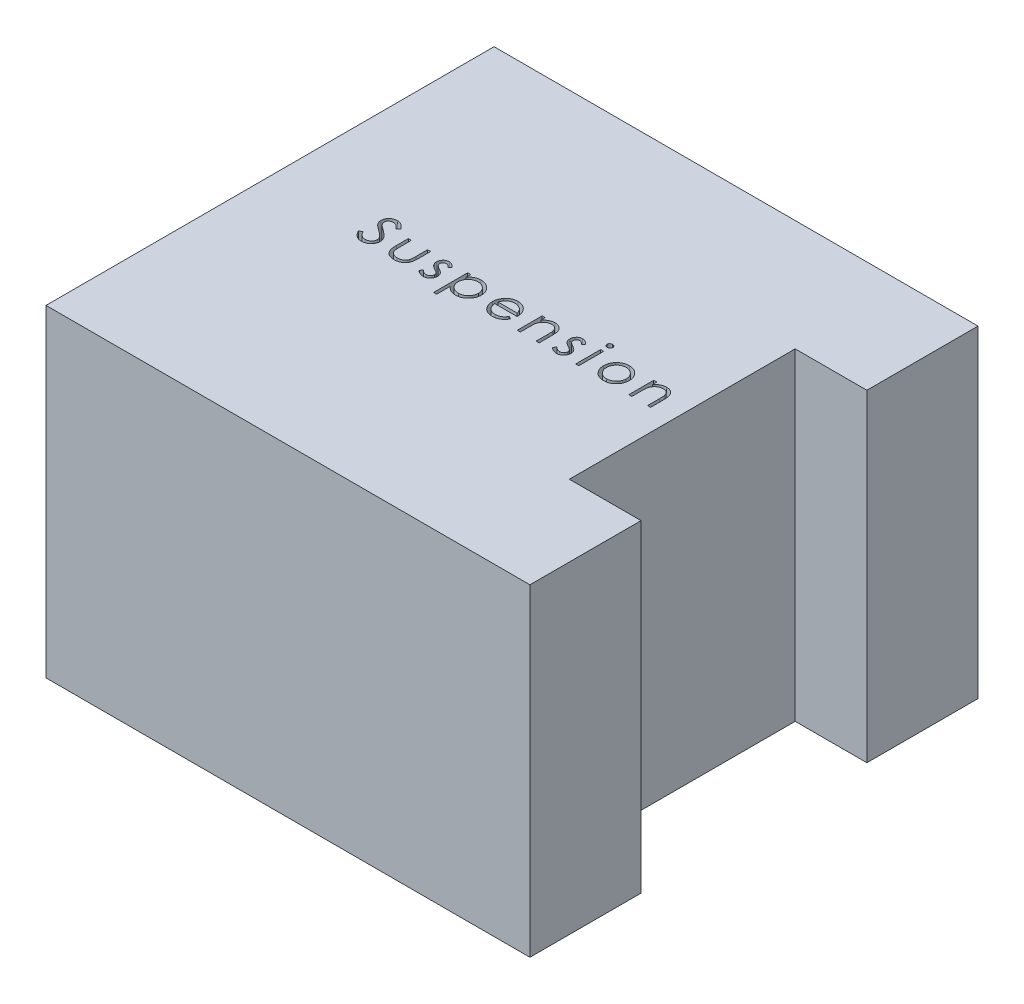
from build123d import *

# Parameters (mm, degrees)
BOSS_EXTRUDE1_DEPTH      = 90
BOSS_EXTRUDE1_DEPTH_BACK = 90
SKETCH1_W                = 270
SKETCH1_H                = 250
SKETCH2_W                = 1.709615384
SKETCH2_H                = 13.921153847
CUT_EXTRUDE1_DEPTH       = 50
SKETCH3_W                = 80.009413916
SKETCH3_H                = 126
CUT_EXTRUDE2_DEPTH       = 258.390753626


with BuildPart() as part:
    # Sketch1 → Boss-Extrude1 (new, two sides: drawn at the far end of the back side and taken through both)
    with BuildSketch(Plane(origin=(0, 0, 0), x_dir=(1, 0, 0), z_dir=(0, 1, 0)).offset(-BOSS_EXTRUDE1_DEPTH_BACK)):
        Rectangle(SKETCH1_W, SKETCH1_H)
    extrude(amount=BOSS_EXTRUDE1_DEPTH + BOSS_EXTRUDE1_DEPTH_BACK)

    # Sketch2 → Cut-Extrude1 (cut)
    # profile 1 of 11: a face of its own
    with BuildSketch(Plane(origin=(0, 90, 0), x_dir=(1, 0, 0), z_dir=(0, 1, 0))):
        with BuildLine():
            Line((-83.832526116, -1.8806457), (-82.222129481, -0.91517094))
            add(Edge.make_bspline(
                [(-82.222129481, -0.91517094), (-82.072351647, -1.165892807), (-81.785383097, -1.646266228), (-81.306676413, -2.295370705), (-80.810652997, -2.847070444), (-80.293639624, -3.298155979), (-79.758792107, -3.653296349), (-79.2026189, -3.904768495), (-78.626994244, -4.061609733), (-78.235251016, -4.080660204), (-78.039677558, -4.09017094)],
                knots=[0, 0, 0, 0, 1.272034388, 2.437168799, 3.508375237, 4.49857839, 5.41946034, 6.295179144, 7.148887113, 8, 8, 8, 8], degree=3))
            add(Edge.make_bspline(
                [(-78.039677558, -4.09017094), (-77.87265336, -4.08551908), (-77.541527496, -4.076296756), (-77.054053002, -3.987682676), (-76.580623478, -3.851545231), (-76.130996464, -3.656577018), (-75.711376048, -3.420691832), (-75.343402463, -3.135779066), (-75.025288619, -2.81679386), (-74.765070438, -2.460925412), (-74.565426246, -2.078199217), (-74.411980845, -1.685355825), (-74.326826944, -1.276224046), (-74.313999472, -1.000758527), (-74.307526116, -0.861745459)],
                knots=[0, 0, 0, 0, 1.095163259, 2.171163733, 3.241058638, 4.321873601, 5.38011039, 6.391990106, 7.366004449, 8.327778327, 9.272591725, 10.192022065, 11.087607919, 12, 12, 12, 12], degree=3))
            add(Edge.make_bspline(
                [(-74.307526116, -0.861745459), (-74.315550578, -0.703135977), (-74.331863138, -0.380706078), (-74.469738765, 0.094997747), (-74.686632523, 0.56576445), (-74.886726341, 0.856964196), (-74.990609049, 1.008146368)],
                knots=[0, 0, 0, 0, 0.938893495, 1.908633276, 2.914225137, 4, 4, 4, 4], degree=3))
            add(Edge.make_bspline(
                [(-74.990609049, 1.008146368), (-75.075901963, 1.117258365), (-75.254963768, 1.346325354), (-75.562798229, 1.687294421), (-75.924019508, 2.039003244), (-76.326266, 2.414881826), (-76.784190383, 2.797448262), (-77.28345014, 3.204945603), (-77.836792001, 3.621877044), (-78.224864976, 3.90149058), (-78.425104241, 4.04576656)],
                knots=[0, 0, 0, 0, 0.722233717, 1.516239348, 2.393582979, 3.351407094, 4.387010283, 5.505090956, 6.712668013, 8, 8, 8, 8], degree=3))
            add(Edge.make_bspline(
                [(-78.425104241, 4.04576656), (-78.625531991, 4.188525015), (-79.008734588, 4.461468311), (-79.544630587, 4.866549057), (-80.023844021, 5.236902118), (-80.444244954, 5.576013956), (-80.805648474, 5.883930561), (-81.110902468, 6.157695059), (-81.3522309, 6.404711297), (-81.486427703, 6.564956314), (-81.54667876, 6.636902377)],
                knots=[0, 0, 0, 0, 1.452282411, 2.77665338, 3.964542531, 5.026858415, 5.96415736, 6.766646006, 7.446254459, 8, 8, 8, 8], degree=3))
            add(Edge.make_bspline(
                [(-81.54667876, 6.636902377), (-81.630893613, 6.749030878), (-81.796513425, 6.969546623), (-82.015131254, 7.314214777), (-82.200945841, 7.66703855), (-82.346609391, 8.028966042), (-82.469270811, 8.394916154), (-82.551773262, 8.769663649), (-82.60343358, 9.151526987), (-82.608723964, 9.408503326), (-82.61137227, 9.537142762)],
                knots=[0, 0, 0, 0, 1.068054152, 2.10047183, 3.106115577, 4.101338837, 5.06977816, 6.043150881, 7.020423561, 8, 8, 8, 8], degree=3))
            add(Edge.make_bspline(
                [(-82.61137227, 9.537142762), (-82.604268204, 9.738690535), (-82.590211916, 10.137478139), (-82.4713371, 10.720031659), (-82.283706065, 11.27621773), (-82.02084389, 11.800529975), (-81.681986012, 12.279316242), (-81.289850065, 12.718083935), (-80.822790405, 13.086938647), (-80.310331127, 13.409221422), (-79.749410016, 13.661475672), (-79.161630956, 13.851763293), (-78.546059749, 13.959582253), (-78.129119831, 13.975055016), (-77.917562174, 13.982905983)],
                knots=[0, 0, 0, 0, 1.005424448, 1.989358655, 2.955360095, 3.929531133, 4.905563448, 5.876582895, 6.856512386, 7.866279853, 8.892233794, 9.918561126, 10.94386622, 12, 12, 12, 12], degree=3))
            add(Edge.make_bspline(
                [(-77.917562174, 13.982905983), (-77.693076428, 13.975163238), (-77.246645927, 13.959765389), (-76.589969483, 13.82588454), (-75.957723298, 13.604356598), (-75.449124956, 13.352958331), (-75.051073783, 13.101871625), (-74.747510767, 12.873163724), (-74.439894356, 12.609864919), (-74.125743229, 12.31127388), (-73.810380497, 11.974650849), (-73.489124278, 11.602301242), (-73.161223329, 11.196500559), (-72.950280719, 10.906807205), (-72.8421415, 10.758296608)],
                knots=[0, 0, 0, 0, 1.286793592, 2.559021753, 3.825965368, 5.121522368, 5.803751409, 6.523245864, 7.299691795, 8.125521123, 9.008227632, 9.944561021, 10.946284179, 12, 12, 12, 12], degree=3))
            Line((-72.8421415, 10.758296608), (-74.387664337, 9.586752137))
            add(Edge.make_bspline(
                [(-74.387664337, 9.586752137), (-74.480987198, 9.706977723), (-74.660705209, 9.938504093), (-74.933552844, 10.262742254), (-75.190720485, 10.558923378), (-75.444087661, 10.816180718), (-75.680272998, 11.048602329), (-75.909510042, 11.247591863), (-76.128499868, 11.415099032), (-76.404544768, 11.593861837), (-76.751351206, 11.771062235), (-77.18669561, 11.921007931), (-77.641643765, 12.011114768), (-77.951503616, 12.023028571), (-78.108367462, 12.029059829)],
                knots=[0, 0, 0, 0, 1.181633172, 2.275549214, 3.290209073, 4.226197932, 5.078386478, 5.862611352, 6.581680152, 7.217281963, 8.414376989, 9.595101626, 10.782541182, 12, 12, 12, 12], degree=3))
            add(Edge.make_bspline(
                [(-78.108367462, 12.029059829), (-78.305162248, 12.022464719), (-78.684662455, 12.009746671), (-79.223452169, 11.870845037), (-79.708377675, 11.652140912), (-80.12504235, 11.345626531), (-80.471953611, 10.982473699), (-80.722899037, 10.56457736), (-80.873939218, 10.103118854), (-80.892370255, 9.781219267), (-80.901756885, 9.617280983)],
                knots=[0, 0, 0, 0, 1.14458467, 2.207223713, 3.21896685, 4.227309161, 5.202851033, 6.127160689, 7.046193047, 8, 8, 8, 8], degree=3))
            add(Edge.make_bspline(
                [(-80.901756885, 9.617280983), (-80.899617153, 9.515219364), (-80.89533419, 9.310929235), (-80.835599934, 9.009115067), (-80.758859301, 8.708063348), (-80.637251548, 8.409127576), (-80.469364967, 8.107079708), (-80.248901081, 7.796718536), (-79.971242911, 7.475308522), (-79.758552315, 7.266262673), (-79.646258087, 7.155892762)],
                knots=[0, 0, 0, 0, 0.858281714, 1.717966888, 2.583508476, 3.4729293, 4.427298488, 5.488583878, 6.674047936, 8, 8, 8, 8], degree=3))
            add(Edge.make_bspline(
                [(-79.646258087, 7.155892762), (-79.604558331, 7.118679807), (-79.505489257, 7.030270344), (-79.324373147, 6.88553236), (-79.085198774, 6.706991556), (-78.794211651, 6.486080591), (-78.446046439, 6.229822919), (-78.040664855, 5.941495115), (-77.582585655, 5.611737117), (-77.257527798, 5.381191074), (-77.085651116, 5.259288194)],
                knots=[0, 0, 0, 0, 0.420754252, 0.999615792, 1.744751191, 2.668019286, 3.750313428, 4.999500688, 6.413464383, 8, 8, 8, 8], degree=3))
            add(Edge.make_bspline(
                [(-77.085651116, 5.259288194), (-76.878899216, 5.108840223), (-76.478552818, 4.817518578), (-75.908916562, 4.37982752), (-75.39242312, 3.951758951), (-74.927259112, 3.536046547), (-74.508829082, 3.135843641), (-74.141775203, 2.746335473), (-73.822357428, 2.370312571), (-73.478481968, 1.888224694), (-73.127102978, 1.296144793), (-72.825342774, 0.57073038), (-72.635069483, -0.157503879), (-72.610187377, -0.646962803), (-72.597910731, -0.8884582)],
                knots=[0, 0, 0, 0, 1.163667725, 2.253281268, 3.268753668, 4.215851969, 5.092017293, 5.902905408, 6.650798638, 7.335211899, 8.59617414, 9.77448103, 10.901945474, 12, 12, 12, 12], degree=3))
            add(Edge.make_bspline(
                [(-72.597910731, -0.8884582), (-72.60148744, -1.059246158), (-72.608571401, -1.397505489), (-72.690001517, -1.894193836), (-72.809307123, -2.376598998), (-72.989124068, -2.838758053), (-73.208597258, -3.289125975), (-73.487087836, -3.715888976), (-73.809891091, -4.128492374), (-74.180189154, -4.515933949), (-74.585387566, -4.871603958), (-75.013651675, -5.187992136), (-75.465682446, -5.451798296), (-75.939027684, -5.667067879), (-76.433796117, -5.835434596), (-76.94982134, -5.957424641), (-77.487953966, -6.03229501), (-77.853716587, -6.040066112), (-78.039677558, -6.044017094)],
                knots=[0, 0, 0, 0, 0.983748083, 1.948392443, 2.894712957, 3.844097841, 4.80183111, 5.778335162, 6.776009319, 7.81870978, 8.863265674, 9.881300176, 10.883814829, 11.87499822, 12.874611388, 13.892143829, 14.928324115, 16, 16, 16, 16], degree=3))
            add(Edge.make_bspline(
                [(-78.039677558, -6.044017094), (-78.183561354, -6.041234806), (-78.469516876, -6.035705269), (-78.892478485, -5.986821443), (-79.306895392, -5.917658493), (-79.707567412, -5.807853912), (-80.099656753, -5.674629223), (-80.481458129, -5.510590584), (-80.85315658, -5.314009816), (-81.216835138, -5.089246896), (-81.571568859, -4.827675458), (-81.914030535, -4.523019713), (-82.25545653, -4.183682036), (-82.585769359, -3.800447398), (-82.91165033, -3.379507262), (-83.226674245, -2.916923278), (-83.53736188, -2.415215109), (-83.732300354, -2.062163714), (-83.832526116, -1.8806457)],
                knots=[0, 0, 0, 0, 0.915332311, 1.819136955, 2.706846663, 3.586547465, 4.459518054, 5.340707479, 6.227863349, 7.133153174, 8.059268498, 9.028702269, 10.047606654, 11.120612155, 12.245963614, 13.433783089, 14.680604001, 16, 16, 16, 16], degree=3))
        make_face()
    # profile 2 of 11: a face of its own
    with BuildSketch(Plane(origin=(0, 90, 0), x_dir=(1, 0, 0), z_dir=(0, 1, 0))):
        with BuildLine():
            Line((-66.199064577, 8.365598291), (-64.489449193, 8.365598291))
            Line((-64.489449193, 8.365598291), (-64.489449193, 1.908747329))
            add(Edge.make_bspline(
                [(-64.489449193, 1.908747329), (-64.488676825, 1.71921208), (-64.487199321, 1.356640026), (-64.477179342, 0.834913939), (-64.453611261, 0.35911726), (-64.424144588, -0.071024865), (-64.386250675, -0.455439667), (-64.341165528, -0.792784454), (-64.290773261, -1.086884798), (-64.241446204, -1.264013634), (-64.218505683, -1.346390892)],
                knots=[0, 0, 0, 0, 1.388932606, 2.656963016, 3.823490214, 4.879454478, 5.816252168, 6.653371382, 7.373723809, 8, 8, 8, 8], degree=3))
            add(Edge.make_bspline(
                [(-64.218505683, -1.346390892), (-64.181704049, -1.449929661), (-64.108865879, -1.654854654), (-63.976748775, -1.950886239), (-63.813308828, -2.225071705), (-63.63445748, -2.487983872), (-63.428176418, -2.731834686), (-63.197075582, -2.956212356), (-62.948890892, -3.169594624), (-62.58010998, -3.42206042), (-62.075778832, -3.69265386), (-61.413640264, -3.926129671), (-60.695704405, -4.065661777), (-60.199507862, -4.081850222), (-59.944467222, -4.09017094)],
                knots=[0, 0, 0, 0, 0.725840625, 1.436591201, 2.137033971, 2.831655856, 3.53531722, 4.242432219, 4.957935707, 5.694543706, 7.190802206, 8.724350549, 10.316345118, 12, 12, 12, 12], degree=3))
            add(Edge.make_bspline(
                [(-59.944467222, -4.09017094), (-59.689450272, -4.081673287), (-59.196039661, -4.065231901), (-58.485991899, -3.930338641), (-57.836923487, -3.70497339), (-57.255349023, -3.390335906), (-56.743906379, -3.005296964), (-56.317706614, -2.553491877), (-55.966058557, -2.0492145), (-55.81251871, -1.672980925), (-55.735302558, -1.4837707)],
                knots=[0, 0, 0, 0, 1.157059328, 2.238695713, 3.266970494, 4.264342957, 5.228770407, 6.160125903, 7.074715775, 8, 8, 8, 8], degree=3))
            add(Edge.make_bspline(
                [(-55.735302558, -1.4837707), (-55.712473963, -1.407754131), (-55.662005515, -1.239700064), (-55.607781859, -0.954604576), (-55.558935146, -0.614618657), (-55.517225573, -0.21751755), (-55.487479474, 0.235661008), (-55.471444672, 0.744775394), (-55.453329345, 1.308227369), (-55.453054393, 1.70265903), (-55.452910731, 1.908747329)],
                knots=[0, 0, 0, 0, 0.557542046, 1.232589297, 2.036731608, 2.971723315, 4.038036528, 5.22795436, 6.551621927, 8, 8, 8, 8], degree=3))
            Line((-55.452910731, 1.908747329), (-55.452910731, 8.365598291))
            Line((-55.452910731, 8.365598291), (-53.743295347, 8.365598291))
            Line((-53.743295347, 8.365598291), (-53.743295347, 1.588194444))
            add(Edge.make_bspline(
                [(-53.743295347, 1.588194444), (-53.745699428, 1.357922554), (-53.750363676, 0.911163588), (-53.78033936, 0.261917209), (-53.831772252, -0.343123009), (-53.909837437, -0.904277335), (-54.001634894, -1.421117342), (-54.12005118, -1.894305441), (-54.261447017, -2.322383728), (-54.420952749, -2.71286397), (-54.609394628, -3.066904923), (-54.809838839, -3.402924154), (-55.041295097, -3.712584272), (-55.284973087, -4.011299905), (-55.556036385, -4.284213075), (-55.849405617, -4.537586108), (-56.160951603, -4.775292181), (-56.497587952, -4.98806043), (-56.854400237, -5.1797396), (-57.231828944, -5.349644254), (-57.634496949, -5.484096852), (-58.05720903, -5.600087761), (-58.502036215, -5.691062229), (-58.968549668, -5.755214828), (-59.456592251, -5.794541272), (-59.78920231, -5.798008616), (-59.959731645, -5.799786325)],
                knots=[0, 0, 0, 0, 1.493040784, 2.896703357, 4.213163133, 5.428574705, 6.569057535, 7.615249723, 8.588095153, 9.490268104, 10.346124644, 11.18633936, 12.024365274, 12.850166724, 13.684164916, 14.514361689, 15.362232829, 16.222528818, 17.093394965, 17.986930858, 18.902426812, 19.842810585, 20.827885679, 21.843828298, 22.894529745, 24, 24, 24, 24], degree=3))
            add(Edge.make_bspline(
                [(-59.959731645, -5.799786325), (-60.128985529, -5.797937347), (-60.461585167, -5.794303934), (-60.949652939, -5.755432095), (-61.417458925, -5.691161909), (-61.863339951, -5.599421369), (-62.287743456, -5.484908717), (-62.692388533, -5.348818045), (-63.072537069, -5.179651423), (-63.432756262, -4.989273575), (-63.770226404, -4.773925433), (-64.086503093, -4.537879389), (-64.381162248, -4.281487817), (-64.654268861, -4.005821487), (-64.90198949, -3.707460734), (-65.127411089, -3.388805613), (-65.334004013, -3.053013502), (-65.520981343, -2.693441146), (-65.681609612, -2.298442064), (-65.823424594, -1.861396436), (-65.939415354, -1.377512737), (-66.033807932, -0.84720467), (-66.10974363, -0.273010229), (-66.162463918, 0.348392146), (-66.191941511, 1.015488813), (-66.196639031, 1.476226072), (-66.199064577, 1.714125935)],
                knots=[0, 0, 0, 0, 1.083640291, 2.129454052, 3.13281866, 4.105697902, 5.042300162, 5.946461698, 6.836384745, 7.703652036, 8.553297018, 9.397182691, 10.228592656, 11.052265423, 11.879314572, 12.708807002, 13.549817954, 14.402308542, 15.300838682, 16.27712199, 17.341985831, 18.484375296, 19.725102775, 21.0496083, 22.476576903, 24, 24, 24, 24], degree=3))
            Line((-66.199064577, 1.714125935), (-66.199064577, 8.365598291))
        make_face()
    # profile 3 of 11: a face of its own
    with BuildSketch(Plane(origin=(0, 90, 0), x_dir=(1, 0, 0), z_dir=(0, 1, 0))):
        with BuildLine():
            Line((-40.017526116, 6.629270166), (-41.17762227, 5.43482906))
            add(Edge.make_bspline(
                [(-41.17762227, 5.43482906), (-41.277719153, 5.550833471), (-41.470694161, 5.774476318), (-41.776754079, 6.073490923), (-42.08168255, 6.32460769), (-42.381305378, 6.536619271), (-42.683156814, 6.696906769), (-42.983694611, 6.813900232), (-43.283229945, 6.88630006), (-43.483451079, 6.895631505), (-43.581768904, 6.900213675)],
                knots=[0, 0, 0, 0, 1.26578478, 2.440284043, 3.530471711, 4.527705817, 5.468200915, 6.346673037, 7.188140097, 8, 8, 8, 8], degree=3))
            add(Edge.make_bspline(
                [(-43.581768904, 6.900213675), (-43.70227044, 6.894363295), (-43.93940041, 6.882850575), (-44.279175221, 6.76793319), (-44.594592194, 6.591537056), (-44.867589471, 6.341336623), (-45.098843844, 6.054148246), (-45.267646879, 5.733039677), (-45.370876018, 5.387701039), (-45.383964631, 5.148052814), (-45.390603039, 5.026505743)],
                knots=[0, 0, 0, 0, 0.99966794, 1.967205029, 2.953328237, 3.988086729, 5.028030931, 6.008226631, 6.989793394, 8, 8, 8, 8], degree=3))
            add(Edge.make_bspline(
                [(-45.390603039, 5.026505743), (-45.384557046, 4.916494474), (-45.372482105, 4.696782056), (-45.278610894, 4.372670615), (-45.129116987, 4.05667445), (-44.989397786, 3.863110631), (-44.917405924, 3.763374733)],
                knots=[0, 0, 0, 0, 0.960159726, 1.917612774, 2.927026955, 4, 4, 4, 4], degree=3))
            add(Edge.make_bspline(
                [(-44.917405924, 3.763374733), (-44.874061765, 3.710118638), (-44.781809185, 3.596769753), (-44.608679982, 3.439450208), (-44.412614645, 3.265593099), (-44.176830413, 3.091765458), (-43.911485532, 2.908712782), (-43.610826, 2.723644029), (-43.284393337, 2.522451945), (-43.050691711, 2.394847232), (-42.929214818, 2.328518964)],
                knots=[0, 0, 0, 0, 0.66740084, 1.420478572, 2.27185888, 3.217733974, 4.268547843, 5.408967954, 6.65319498, 8, 8, 8, 8], degree=3))
            add(Edge.make_bspline(
                [(-42.929214818, 2.328518964), (-42.781095205, 2.245543136), (-42.494976887, 2.085261158), (-42.088434825, 1.836469772), (-41.719479645, 1.589193019), (-41.384985225, 1.346075429), (-41.091387666, 1.100314821), (-40.829779172, 0.861331172), (-40.606684927, 0.621903651), (-40.481749983, 0.454627704), (-40.422033327, 0.37467281)],
                knots=[0, 0, 0, 0, 1.27191281, 2.456916733, 3.569705269, 4.599008579, 5.553216877, 6.436649441, 7.252746552, 8, 8, 8, 8], degree=3))
            add(Edge.make_bspline(
                [(-40.422033327, 0.37467281), (-40.322916028, 0.213204531), (-40.125654207, -0.108147313), (-39.9185085, -0.637293325), (-39.798437575, -1.19850906), (-39.781770348, -1.582405858), (-39.773295347, -1.777610844)],
                knots=[0, 0, 0, 0, 0.995354457, 1.980940102, 2.973342416, 4, 4, 4, 4], degree=3))
            add(Edge.make_bspline(
                [(-39.773295347, -1.777610844), (-39.777211666, -1.915147197), (-39.784929202, -2.186177606), (-39.838585252, -2.585328607), (-39.930868766, -2.967060985), (-40.05656477, -3.335516749), (-40.226296857, -3.68363612), (-40.425221296, -4.020201989), (-40.664026172, -4.337933841), (-40.936666374, -4.636414467), (-41.235182563, -4.909024036), (-41.553623116, -5.148640127), (-41.892380179, -5.34770902), (-42.249033199, -5.51243897), (-42.624392516, -5.64343906), (-43.018516819, -5.734130837), (-43.430153326, -5.788411151), (-43.710078424, -5.795946657), (-43.852712414, -5.799786325)],
                knots=[0, 0, 0, 0, 1.032770009, 2.035186124, 3.017557409, 3.978232242, 4.952395191, 5.920591857, 6.910227898, 7.931268572, 8.952309245, 9.941945286, 10.918353717, 11.897095711, 12.887975737, 13.898235213, 14.929059601, 16, 16, 16, 16], degree=3))
            add(Edge.make_bspline(
                [(-43.852712414, -5.799786325), (-44.045210897, -5.794383199), (-44.427533114, -5.783652023), (-44.992990014, -5.682926175), (-45.545553, -5.52619696), (-46.081040555, -5.310028804), (-46.587477261, -5.037065638), (-47.050832722, -4.71015461), (-47.472716539, -4.340094767), (-47.712846001, -4.056451639), (-47.832910731, -3.914630075)],
                knots=[0, 0, 0, 0, 1.013940152, 2.01379169, 3.017749504, 4.037548394, 5.051665909, 6.043208538, 7.021604269, 8, 8, 8, 8], degree=3))
            Line((-47.832910731, -3.914630075), (-46.699527318, -2.624786325))
            add(Edge.make_bspline(
                [(-46.699527318, -2.624786325), (-46.591908899, -2.741017257), (-46.383274321, -2.966348495), (-46.049620555, -3.266382406), (-45.710098386, -3.517849325), (-45.368098163, -3.728179911), (-45.018557364, -3.890243177), (-44.663434807, -4.004100095), (-44.303452813, -4.077274913), (-44.061669474, -4.085865278), (-43.940482847, -4.09017094)],
                knots=[0, 0, 0, 0, 1.179806542, 2.287233372, 3.337373186, 4.324005949, 5.273901747, 6.200048787, 7.097828587, 8, 8, 8, 8], degree=3))
            add(Edge.make_bspline(
                [(-43.940482847, -4.09017094), (-43.775466707, -4.082709736), (-43.45305285, -4.068131795), (-42.991260393, -3.935777337), (-42.56487444, -3.728241457), (-42.194633088, -3.433866171), (-41.879479897, -3.091207983), (-41.651270834, -2.705232562), (-41.508253364, -2.287267634), (-41.491456715, -1.997531815), (-41.482910731, -1.850116854)],
                knots=[0, 0, 0, 0, 1.072336372, 2.095165389, 3.102688358, 4.141489647, 5.156069229, 6.117746104, 7.042326257, 8, 8, 8, 8], degree=3))
            add(Edge.make_bspline(
                [(-41.482910731, -1.850116854), (-41.488823276, -1.728688786), (-41.500496805, -1.488945322), (-41.592172328, -1.141961323), (-41.737022281, -0.812835667), (-41.879650438, -0.620214872), (-41.952291741, -0.522112046)],
                knots=[0, 0, 0, 0, 1.013901739, 2.00181326, 2.98231254, 4, 4, 4, 4], degree=3))
            add(Edge.make_bspline(
                [(-41.952291741, -0.522112046), (-41.995956488, -0.472933861), (-42.091074076, -0.365806011), (-42.265546175, -0.211092368), (-42.474453168, -0.044333571), (-42.720144626, 0.131642649), (-43.003115841, 0.314515058), (-43.324513699, 0.503324246), (-43.679935278, 0.707038011), (-43.931235429, 0.842127849), (-44.062598231, 0.912743723)],
                knots=[0, 0, 0, 0, 0.615000592, 1.339693406, 2.178160186, 3.116406724, 4.166410947, 5.330106347, 6.604359322, 8, 8, 8, 8], degree=3))
            add(Edge.make_bspline(
                [(-44.062598231, 0.912743723), (-44.204366372, 0.99187814), (-44.479300041, 1.145345029), (-44.868721724, 1.38437398), (-45.220043752, 1.627491575), (-45.541719736, 1.861060028), (-45.825624639, 2.097394023), (-46.070640015, 2.336755921), (-46.286412375, 2.569492416), (-46.405869002, 2.734396273), (-46.46292876, 2.813164396)],
                knots=[0, 0, 0, 0, 1.262093308, 2.447601706, 3.550203992, 4.582594899, 5.537233252, 6.418365656, 7.244515135, 8, 8, 8, 8], degree=3))
            add(Edge.make_bspline(
                [(-46.46292876, 2.813164396), (-46.561611024, 2.971799815), (-46.759010037, 3.28912609), (-46.950681292, 3.818773113), (-47.082431249, 4.376366925), (-47.09420083, 4.761105375), (-47.100218424, 4.957815839)],
                knots=[0, 0, 0, 0, 0.985009483, 1.970363186, 2.962279964, 4, 4, 4, 4], degree=3))
            add(Edge.make_bspline(
                [(-47.100218424, 4.957815839), (-47.097310875, 5.086405505), (-47.09162039, 5.338073699), (-47.046204909, 5.707854993), (-46.963518595, 6.059181373), (-46.859805374, 6.397329013), (-46.715662164, 6.715747553), (-46.543418023, 7.018683217), (-46.341012182, 7.305717285), (-46.10782227, 7.572434333), (-45.851427529, 7.814692237), (-45.574414568, 8.025867627), (-45.283013486, 8.206060786), (-44.975990517, 8.357182589), (-44.650396228, 8.471490114), (-44.308506497, 8.550179596), (-43.951013354, 8.602731485), (-43.70662294, 8.60742913), (-43.581768904, 8.60982906)],
                knots=[0, 0, 0, 0, 1.087655834, 2.128696564, 3.144119009, 4.137814668, 5.115653402, 6.093965665, 7.082169637, 8.081268856, 9.086088321, 10.061021666, 11.022561449, 11.980240094, 12.950172527, 13.934149372, 14.944599409, 16, 16, 16, 16], degree=3))
            add(Edge.make_bspline(
                [(-43.581768904, 8.60982906), (-43.433766387, 8.603818291), (-43.13498498, 8.591683998), (-42.686740516, 8.495314454), (-42.239156182, 8.33674713), (-41.791081949, 8.11774706), (-41.345800231, 7.834354492), (-40.899394197, 7.491839306), (-40.446504775, 7.092454888), (-40.163713985, 6.787114819), (-40.017526116, 6.629270166)],
                knots=[0, 0, 0, 0, 0.845714091, 1.707292901, 2.609013841, 3.555613372, 4.552488639, 5.621697636, 6.770543573, 8, 8, 8, 8], degree=3))
        make_face()
    # profile 4 of 11: a face of its own
    with BuildSketch(Plane(origin=(0, 90, 0), x_dir=(1, 0, 0), z_dir=(0, 1, 0))):
        with BuildLine():
            Line((-33.130218424, 8.365598291), (-31.420603039, 8.365598291))
            Line((-31.420603039, 8.365598291), (-31.420603039, 5.789726896))
            add(Edge.make_bspline(
                [(-31.420603039, 5.789726896), (-31.239043019, 6.023430848), (-30.886217453, 6.477587708), (-30.278114757, 7.06536255), (-29.636255982, 7.561072417), (-28.944123694, 7.949597347), (-28.212474753, 8.242536337), (-27.444311711, 8.4590502), (-26.633115005, 8.586638798), (-26.07850717, 8.601996697), (-25.795663135, 8.60982906)],
                knots=[0, 0, 0, 0, 1.0828784, 2.104357462, 3.088488658, 4.04616522, 5.001424249, 5.969181776, 6.964304535, 8, 8, 8, 8], degree=3))
            add(Edge.make_bspline(
                [(-25.795663135, 8.60982906), (-25.548603123, 8.602681615), (-25.060276031, 8.588554314), (-24.341474742, 8.492906688), (-23.649277298, 8.328980391), (-22.987599747, 8.092755409), (-22.349353635, 7.800716351), (-21.743987634, 7.4321422), (-21.162072425, 7.005388505), (-20.618242881, 6.514267798), (-20.115750866, 5.982891091), (-19.681159509, 5.411269693), (-19.306299573, 4.818201901), (-19.003294102, 4.194493513), (-18.765940097, 3.545055991), (-18.597131637, 2.867265477), (-18.49666932, 2.163635001), (-18.483190348, 1.68519305), (-18.47637227, 1.443182425)],
                knots=[0, 0, 0, 0, 1.041296284, 2.058176809, 3.050446431, 4.034000596, 5.01514041, 6.003636468, 7.015969324, 8.052561599, 9.08815499, 10.094063707, 11.074456064, 12.040834395, 13.011057502, 13.983766392, 14.980127149, 16, 16, 16, 16], degree=3))
            add(Edge.make_bspline(
                [(-18.47637227, 1.443182425), (-18.483042413, 1.196064146), (-18.496196897, 0.708711237), (-18.598223286, -0.006954249), (-18.761274273, -0.695406955), (-18.995633812, -1.355501776), (-19.298482484, -1.986784221), (-19.666988734, -2.588799033), (-20.101799363, -3.161353332), (-20.598738358, -3.696674117), (-21.137869338, -4.189793234), (-21.714145388, -4.621074727), (-22.318623254, -4.983249927), (-22.948210336, -5.285780036), (-23.608296311, -5.513793209), (-24.295801437, -5.678264381), (-25.010351405, -5.779689279), (-25.496404818, -5.79303594), (-25.742237654, -5.799786325)],
                knots=[0, 0, 0, 0, 1.038740735, 2.04854663, 3.033179607, 4.009277356, 4.987731542, 5.972001279, 6.972200261, 8.005528982, 9.039189865, 10.040446548, 11.026516639, 11.997840187, 12.972163198, 13.956796175, 14.96660207, 16, 16, 16, 16], degree=3))
            add(Edge.make_bspline(
                [(-25.742237654, -5.799786325), (-26.018884867, -5.792738871), (-26.56534422, -5.778818085), (-27.364342969, -5.637742439), (-28.133292691, -5.426902832), (-28.86367418, -5.118298309), (-29.561273274, -4.725021859), (-30.222143931, -4.245450595), (-30.849796543, -3.68058748), (-31.227578494, -3.252061452), (-31.420603039, -3.033109642)],
                knots=[0, 0, 0, 0, 1.014726462, 2.004382257, 2.969841629, 3.936926163, 4.907207904, 5.903978561, 6.929055279, 8, 8, 8, 8], degree=3))
            Line((-31.420603039, -3.033109642), (-31.420603039, -10.684401709))
            Line((-31.420603039, -10.684401709), (-33.130218424, -10.684401709))
            Line((-33.130218424, -10.684401709), (-33.130218424, 8.365598291))
        make_face()
        with BuildLine():
            add(Edge.make_bspline(
                [(-25.810927558, 6.900213675), (-26.004582034, 6.896728841), (-26.385837782, 6.889868101), (-26.944668002, 6.808367037), (-27.482941687, 6.690051617), (-27.995234023, 6.510916846), (-28.486455236, 6.291031877), (-28.952821904, 6.016265502), (-29.394006664, 5.691588156), (-29.808899501, 5.323219155), (-30.18371257, 4.917319781), (-30.515525078, 4.484134706), (-30.794239124, 4.024212518), (-31.025571549, 3.54183733), (-31.201611416, 3.033227992), (-31.326556119, 2.501281166), (-31.405098468, 1.945414617), (-31.415379684, 1.56683121), (-31.420603039, 1.374492521)],
                knots=[0, 0, 0, 0, 1.05670511, 2.080379991, 3.077984906, 4.06214886, 5.038337365, 6.01289324, 7.01187578, 8.025460281, 9.038092164, 10.024533457, 11.000252242, 11.969694649, 12.940728589, 13.933144304, 14.949937299, 16, 16, 16, 16], degree=3))
            add(Edge.make_bspline(
                [(-31.420603039, 1.374492521), (-31.411944236, 1.122008652), (-31.394980909, 0.627371367), (-31.257073235, -0.095353639), (-31.032635583, -0.77925765), (-30.714072156, -1.418581294), (-30.311586073, -2.006316439), (-29.826637536, -2.532589598), (-29.263614509, -2.994092672), (-28.631877365, -3.382828353), (-27.954665483, -3.698449114), (-27.248259304, -3.924405031), (-26.52237331, -4.063591016), (-26.031600026, -4.081262989), (-25.784214818, -4.09017094)],
                knots=[0, 0, 0, 0, 1.03728447, 2.032128127, 3.01272805, 3.987917167, 4.958271349, 5.931593992, 6.91984656, 7.941419022, 8.973179163, 9.983609215, 10.983593296, 12, 12, 12, 12], degree=3))
            add(Edge.make_bspline(
                [(-25.784214818, -4.09017094), (-25.541812995, -4.081699803), (-25.060688955, -4.064886119), (-24.352256894, -3.919353984), (-23.663786419, -3.69704035), (-23.009662909, -3.372866193), (-22.395580782, -2.975591734), (-21.841054041, -2.499014982), (-21.356602126, -1.94661972), (-20.943683279, -1.331530583), (-20.610953337, -0.67199028), (-20.360961603, 0.010442706), (-20.216679226, 0.713362795), (-20.196231562, 1.186878918), (-20.185987654, 1.424101896)],
                knots=[0, 0, 0, 0, 1.00104056, 1.986885549, 2.97790532, 3.984399681, 4.995088187, 5.994304198, 6.996462723, 8.023150851, 9.048424203, 10.043036403, 11.019596776, 12, 12, 12, 12], degree=3))
            add(Edge.make_bspline(
                [(-20.185987654, 1.424101896), (-20.193905563, 1.662798337), (-20.209679691, 2.138331533), (-20.365057139, 2.839169619), (-20.598555589, 3.524359889), (-20.939055572, 4.174893167), (-21.342922482, 4.788706388), (-21.831402565, 5.330563929), (-22.379042149, 5.805021448), (-22.99239317, 6.196991036), (-23.650654628, 6.508787802), (-24.343611528, 6.736754465), (-25.067748849, 6.873771587), (-25.561022226, 6.891322114), (-25.810927558, 6.900213675)],
                knots=[0, 0, 0, 0, 0.983928682, 1.960191568, 2.949917689, 3.96440592, 4.982380491, 5.975291189, 6.965713506, 7.964880129, 8.970154049, 9.96478489, 10.968906225, 12, 12, 12, 12], degree=3))
        make_face(mode=Mode.SUBTRACT)
    # profile 5 of 11: a face of its own
    with BuildSketch(Plane(origin=(0, 90, 0), x_dir=(1, 0, 0), z_dir=(0, 1, 0))):
        with BuildLine():
            Line((-0.407874674, -1.159401709), (1.110935423, -1.956967815))
            add(Edge.make_bspline(
                [(1.110935423, -1.956967815), (0.989904811, -2.171652233), (0.754427171, -2.589343092), (0.349474529, -3.163193647), (-0.075025181, -3.679436215), (-0.538233921, -4.124279047), (-1.026293173, -4.512090157), (-1.54190948, -4.851386031), (-2.087767188, -5.140502549), (-2.663892119, -5.384084165), (-3.275122533, -5.571370126), (-3.922939643, -5.703654529), (-4.608584497, -5.785424034), (-5.078554419, -5.794922586), (-5.319202799, -5.799786325)],
                knots=[0, 0, 0, 0, 1.120438281, 2.179929193, 3.190490725, 4.156257408, 5.095198341, 6.022838206, 6.959905092, 7.901321166, 8.864066838, 9.862729781, 10.905609505, 12, 12, 12, 12], degree=3))
            add(Edge.make_bspline(
                [(-5.319202799, -5.799786325), (-5.586675562, -5.793542413), (-6.108437436, -5.781362351), (-6.867932345, -5.676356223), (-7.583011751, -5.505056671), (-8.253635451, -5.265758509), (-8.87816114, -4.953189788), (-9.457830078, -4.572410323), (-9.995690641, -4.125376194), (-10.474793836, -3.608215266), (-10.906106969, -3.054774898), (-11.286703218, -2.478072155), (-11.604878664, -1.879558034), (-11.863700728, -1.263042753), (-12.072732922, -0.632412132), (-12.218420267, 0.018071713), (-12.302402181, 0.68664825), (-12.31527152, 1.138935177), (-12.321756885, 1.36686031)],
                knots=[0, 0, 0, 0, 1.145258523, 2.234067595, 3.276747158, 4.290159414, 5.277019952, 6.260822364, 7.254936242, 8.264827045, 9.274100331, 10.257902744, 11.220704747, 12.172965371, 13.118907548, 14.062713208, 15.023725156, 16, 16, 16, 16], degree=3))
            add(Edge.make_bspline(
                [(-12.321756885, 1.36686031), (-12.31599213, 1.580736458), (-12.304567147, 2.00461074), (-12.232553861, 2.631984633), (-12.104928152, 3.241739496), (-11.929797017, 3.834381991), (-11.70363952, 4.408919835), (-11.426967013, 4.965702695), (-11.099348499, 5.504138099), (-10.846404375, 5.843789441), (-10.718992462, 6.014877137)],
                knots=[0, 0, 0, 0, 1.024358464, 2.0301432, 3.019427413, 4.004406732, 4.986367066, 5.972626655, 6.978780325, 8, 8, 8, 8], degree=3))
            add(Edge.make_bspline(
                [(-10.718992462, 6.014877137), (-10.546412074, 6.220991987), (-10.206718208, 6.626692491), (-9.632190045, 7.159756807), (-9.010070405, 7.606309355), (-8.348155697, 7.976462482), (-7.638752888, 8.257714761), (-6.891398033, 8.46730603), (-6.097581342, 8.584752061), (-5.554900069, 8.601340984), (-5.277225635, 8.60982906)],
                knots=[0, 0, 0, 0, 1.030682036, 2.02871468, 2.997146059, 3.962720338, 4.930598197, 5.918074684, 6.934738563, 8, 8, 8, 8], degree=3))
            add(Edge.make_bspline(
                [(-5.277225635, 8.60982906), (-4.991760812, 8.602459165), (-4.431743902, 8.588001112), (-3.6151405, 8.453963497), (-2.8424686, 8.241406022), (-2.114037398, 7.941211819), (-1.429773042, 7.553900544), (-0.794123258, 7.074157093), (-0.196217168, 6.516710075), (0.151628097, 6.088013178), (0.32863374, 5.869865118)],
                knots=[0, 0, 0, 0, 1.056321875, 2.072262726, 3.055038591, 4.01806755, 4.982017516, 5.957941055, 6.960871419, 8, 8, 8, 8], degree=3))
            add(Edge.make_bspline(
                [(0.32863374, 5.869865118), (0.449067504, 5.705471339), (0.689133389, 5.377778036), (0.989835462, 4.843446452), (1.250860712, 4.28440736), (1.459501543, 3.691624172), (1.628445114, 3.072120457), (1.75067437, 2.421467463), (1.822354723, 1.739858946), (1.836444632, 1.275438694), (1.84362773, 1.038675214)],
                knots=[0, 0, 0, 0, 0.94817472, 1.890038105, 2.849395472, 3.817997239, 4.812318967, 5.836947057, 6.897266129, 8, 8, 8, 8], degree=3))
            Line((1.84362773, 1.038675214), (-10.6121415, 1.038675214))
            add(Edge.make_bspline(
                [(-10.6121415, 1.038675214), (-10.603761643, 0.855248401), (-10.58728299, 0.494546972), (-10.510456282, -0.033251147), (-10.389359385, -0.536026052), (-10.219166344, -1.010006609), (-10.013062515, -1.461383446), (-9.760591685, -1.886808248), (-9.459386399, -2.284343267), (-9.123422235, -2.657544401), (-8.74945933, -2.989889402), (-8.356034663, -3.287351212), (-7.937513974, -3.536664531), (-7.497197262, -3.73902936), (-7.035796546, -3.89745088), (-6.553166455, -4.00558859), (-6.050256708, -4.078017272), (-5.707434355, -4.086070878), (-5.532904722, -4.09017094)],
                knots=[0, 0, 0, 0, 1.094153842, 2.151609401, 3.174256925, 4.172055639, 5.149267565, 6.128595816, 7.11444997, 8.118368179, 9.117203808, 10.09244225, 11.054858984, 12.015122123, 12.976791628, 13.957293641, 14.960065497, 16, 16, 16, 16], degree=3))
            add(Edge.make_bspline(
                [(-5.532904722, -4.09017094), (-5.362264904, -4.086861375), (-5.023682772, -4.080294562), (-4.51945182, -4.016439447), (-4.023392392, -3.913186946), (-3.537557612, -3.772271429), (-3.071807722, -3.600403134), (-2.640485514, -3.393014723), (-2.243808911, -3.163599673), (-1.873057993, -2.901201299), (-1.513443015, -2.580028167), (-1.156704625, -2.179239457), (-0.77419884, -1.705234484), (-0.534769771, -1.348478788), (-0.407874674, -1.159401709)],
                knots=[0, 0, 0, 0, 0.99110716, 1.966546729, 2.947904876, 3.932708344, 4.903319531, 5.828989031, 6.710028674, 7.56322171, 8.463672341, 9.504779593, 10.677557249, 12, 12, 12, 12], degree=3))
        make_face()
        with BuildLine():
            add(Edge.make_bspline(
                [(0.134012346, 2.748290598), (0.071437861, 2.975055668), (-0.04899788, 3.411505432), (-0.300655807, 4.015885135), (-0.584073764, 4.553029282), (-0.919472045, 5.018826999), (-1.299485394, 5.432503263), (-1.738425603, 5.794010133), (-2.230655252, 6.117410831), (-2.773630003, 6.390383721), (-3.348623147, 6.622738524), (-3.950636849, 6.77854094), (-4.564905666, 6.885272877), (-4.980382282, 6.895212124), (-5.189455202, 6.900213675)],
                knots=[0, 0, 0, 0, 1.154881502, 2.222775134, 3.210006277, 4.132804581, 5.035138423, 5.962687519, 6.919655026, 7.923214229, 8.944639381, 9.960483929, 10.97369054, 12, 12, 12, 12], degree=3))
            add(Edge.make_bspline(
                [(-5.189455202, 6.900213675), (-5.360085718, 6.896884434), (-5.697386373, 6.890303225), (-6.194325044, 6.82787295), (-6.67155312, 6.724677223), (-7.1325919, 6.583353673), (-7.571399769, 6.394983994), (-7.997002722, 6.174095289), (-8.398578878, 5.904447526), (-8.649719358, 5.698931473), (-8.776594625, 5.595105502)],
                knots=[0, 0, 0, 0, 1.04873581, 2.073130211, 3.073294108, 4.04793562, 5.032784715, 6.005352987, 6.992311501, 8, 8, 8, 8], degree=3))
            add(Edge.make_bspline(
                [(-8.776594625, 5.595105502), (-8.867453774, 5.512949299), (-9.051330548, 5.346685165), (-9.297023958, 5.060231913), (-9.532266816, 4.751341267), (-9.746354269, 4.40819566), (-9.942719418, 4.034702563), (-10.126470151, 3.634012291), (-10.291859051, 3.203084254), (-10.384910736, 2.902788549), (-10.432784529, 2.748290598)],
                knots=[0, 0, 0, 0, 0.879870761, 1.780643979, 2.707998968, 3.669668524, 4.684282772, 5.740141944, 6.837334558, 8, 8, 8, 8], degree=3))
            Line((-10.432784529, 2.748290598), (0.134012346, 2.748290598))
        make_face(mode=Mode.SUBTRACT)
    # profile 6 of 11: a face of its own
    with BuildSketch(Plane(origin=(0, 90, 0), x_dir=(1, 0, 0), z_dir=(0, 1, 0))):
        with BuildLine():
            Line((8.486704653, 8.365598291), (10.196320038, 8.365598291))
            Line((10.196320038, 8.365598291), (10.196320038, 5.854600694))
            add(Edge.make_bspline(
                [(10.196320038, 5.854600694), (10.378860595, 6.082344657), (10.733086914, 6.524289763), (11.323007357, 7.105154604), (11.946453443, 7.583827901), (12.599607205, 7.965392836), (13.283355302, 8.253029473), (13.993529886, 8.460761184), (14.734382786, 8.585320036), (15.238197793, 8.601595432), (15.493074846, 8.60982906)],
                knots=[0, 0, 0, 0, 1.12780773, 2.188550248, 3.19190651, 4.159438251, 5.104880172, 6.052711206, 7.014878035, 8, 8, 8, 8], degree=3))
            add(Edge.make_bspline(
                [(15.493074846, 8.60982906), (15.750688726, 8.60033021), (16.254901229, 8.581738671), (16.989023249, 8.43469068), (17.674678434, 8.183528649), (18.309422016, 7.83947438), (18.881614421, 7.411630575), (19.384125398, 6.913185791), (19.799759644, 6.339856538), (20.078419577, 5.807963359), (20.26198346, 5.336128636), (20.37754804, 4.932014182), (20.475688096, 4.481791102), (20.560769467, 3.98681991), (20.618339176, 3.443632618), (20.663745077, 2.854455894), (20.696286256, 2.219480583), (20.69757734, 1.780314797), (20.698243115, 1.553849493)],
                knots=[0, 0, 0, 0, 1.235846778, 2.418850247, 3.575807741, 4.728682307, 5.871620074, 6.994088408, 8.11269785, 9.256955736, 9.865816715, 10.540099792, 11.271859618, 12.076849838, 12.949306005, 13.892391288, 14.913166135, 16, 16, 16, 16], degree=3))
            Line((20.698243115, 1.553849493), (20.698243115, -5.555555556))
            Line((20.698243115, -5.555555556), (18.98862773, -5.555555556))
            Line((18.98862773, -5.555555556), (18.98862773, 0.992881944))
            add(Edge.make_bspline(
                [(18.98862773, 0.992881944), (18.987576127, 1.182415538), (18.985564588, 1.544961045), (18.979220139, 2.064041014), (18.963926764, 2.534775105), (18.94243666, 2.956037919), (18.910982223, 3.327424944), (18.878201901, 3.649692578), (18.838115384, 3.922431659), (18.802394385, 4.086615894), (18.786374125, 4.160249733)],
                knots=[0, 0, 0, 0, 1.430800155, 2.736877192, 3.918605307, 4.986035426, 5.920637409, 6.731861385, 7.431261377, 8, 8, 8, 8], degree=3))
            add(Edge.make_bspline(
                [(18.786374125, 4.160249733), (18.728540874, 4.37639204), (18.617229761, 4.792399107), (18.34218051, 5.356683797), (17.994849041, 5.836733934), (17.570862175, 6.229581519), (17.074315349, 6.535311359), (16.506586472, 6.747441027), (15.873154156, 6.880117577), (15.427632445, 6.89332811), (15.195418596, 6.900213675)],
                knots=[0, 0, 0, 0, 1.084156227, 2.086665306, 3.027808233, 3.945421172, 4.874247719, 5.839848303, 6.874090471, 8, 8, 8, 8], degree=3))
            add(Edge.make_bspline(
                [(15.195418596, 6.900213675), (15.057890203, 6.89762285), (14.785725069, 6.892495673), (14.382137364, 6.841053608), (13.990664365, 6.756915443), (13.607377227, 6.64333043), (13.23994195, 6.487325793), (12.876553451, 6.310273078), (12.530895206, 6.089574953), (12.195596716, 5.843608856), (11.883651291, 5.571034886), (11.593392764, 5.283409766), (11.334650111, 4.977109694), (11.100233464, 4.65706998), (10.897877487, 4.318895262), (10.721239965, 3.965848108), (10.571367112, 3.597463841), (10.496894172, 3.341785293), (10.459631336, 3.213855502)],
                knots=[0, 0, 0, 0, 1.023777757, 2.026029729, 3.023749952, 4.003683103, 4.997618607, 5.993177895, 7.010360494, 8.046726602, 9.087585522, 10.09234134, 11.086953743, 12.070360549, 13.043493632, 14.017870808, 15.008233677, 16, 16, 16, 16], degree=3))
            add(Edge.make_bspline(
                [(10.459631336, 3.213855502), (10.438188392, 3.119937897), (10.391508223, 2.915484183), (10.341090059, 2.579962415), (10.295328827, 2.191832408), (10.257027666, 1.751547083), (10.2335939, 1.257564934), (10.208042969, 0.711995588), (10.198740793, 0.112663601), (10.197149552, -0.30459504), (10.196320038, -0.522112046)],
                knots=[0, 0, 0, 0, 0.615963638, 1.340920617, 2.168419149, 3.115676021, 4.16674242, 5.331190069, 6.6087489, 8, 8, 8, 8], degree=3))
            Line((10.196320038, -0.522112046), (10.196320038, -5.555555556))
            Line((10.196320038, -5.555555556), (8.486704653, -5.555555556))
            Line((8.486704653, -5.555555556), (8.486704653, 8.365598291))
        make_face()
    # profile 7 of 11: a face of its own
    with BuildSketch(Plane(origin=(0, 90, 0), x_dir=(1, 0, 0), z_dir=(0, 1, 0))):
        with BuildLine():
            Line((34.424012346, 6.629270166), (33.263916192, 5.43482906))
            add(Edge.make_bspline(
                [(33.263916192, 5.43482906), (33.163819308, 5.550833471), (32.970844301, 5.774476318), (32.664784383, 6.073490923), (32.359855912, 6.32460769), (32.060233084, 6.536619271), (31.758381648, 6.696906769), (31.457843851, 6.813900232), (31.158308517, 6.88630006), (30.958087382, 6.895631505), (30.859769557, 6.900213675)],
                knots=[0, 0, 0, 0, 1.26578478, 2.440284043, 3.530471711, 4.527705817, 5.468200915, 6.346673037, 7.188140097, 8, 8, 8, 8], degree=3))
            add(Edge.make_bspline(
                [(30.859769557, 6.900213675), (30.739268021, 6.894363295), (30.502138052, 6.882850575), (30.162363241, 6.76793319), (29.846946267, 6.591537056), (29.57394899, 6.341336623), (29.342694618, 6.054148246), (29.173891583, 5.733039677), (29.070662443, 5.387701039), (29.05757383, 5.148052814), (29.050935423, 5.026505743)],
                knots=[0, 0, 0, 0, 0.99966794, 1.967205029, 2.953328237, 3.988086729, 5.028030931, 6.008226631, 6.989793394, 8, 8, 8, 8], degree=3))
            add(Edge.make_bspline(
                [(29.050935423, 5.026505743), (29.056981415, 4.916494474), (29.069056356, 4.696782056), (29.162927568, 4.372670615), (29.312421475, 4.05667445), (29.452140675, 3.863110631), (29.524132538, 3.763374733)],
                knots=[0, 0, 0, 0, 0.960159726, 1.917612774, 2.927026955, 4, 4, 4, 4], degree=3))
            add(Edge.make_bspline(
                [(29.524132538, 3.763374733), (29.567476697, 3.710118638), (29.659729276, 3.596769753), (29.832858479, 3.439450208), (30.028923816, 3.265593099), (30.264708049, 3.091765458), (30.530052929, 2.908712782), (30.830712462, 2.723644029), (31.157145125, 2.522451945), (31.390846751, 2.394847232), (31.512323644, 2.328518964)],
                knots=[0, 0, 0, 0, 0.66740084, 1.420478572, 2.27185888, 3.217733974, 4.268547843, 5.408967954, 6.65319498, 8, 8, 8, 8], degree=3))
            add(Edge.make_bspline(
                [(31.512323644, 2.328518964), (31.660443256, 2.245543136), (31.946561575, 2.085261158), (32.353103636, 1.836469772), (32.722058817, 1.589193019), (33.056553236, 1.346075429), (33.350150796, 1.100314821), (33.61175929, 0.861331172), (33.834853534, 0.621903651), (33.959788478, 0.454627704), (34.019505134, 0.37467281)],
                knots=[0, 0, 0, 0, 1.27191281, 2.456916733, 3.569705269, 4.599008579, 5.553216877, 6.436649441, 7.252746552, 8, 8, 8, 8], degree=3))
            add(Edge.make_bspline(
                [(34.019505134, 0.37467281), (34.118622433, 0.213204531), (34.315884254, -0.108147313), (34.523029962, -0.637293325), (34.643100886, -1.19850906), (34.659768114, -1.582405858), (34.668243115, -1.777610844)],
                knots=[0, 0, 0, 0, 0.995354457, 1.980940102, 2.973342416, 4, 4, 4, 4], degree=3))
            add(Edge.make_bspline(
                [(34.668243115, -1.777610844), (34.664326795, -1.915147197), (34.656609259, -2.186177606), (34.602953209, -2.585328607), (34.510669695, -2.967060985), (34.384973692, -3.335516749), (34.215241605, -3.68363612), (34.016317166, -4.020201989), (33.777512289, -4.337933841), (33.504872088, -4.636414467), (33.206355899, -4.909024036), (32.887915346, -5.148640127), (32.549158282, -5.34770902), (32.192505263, -5.51243897), (31.817145946, -5.64343906), (31.423021643, -5.734130837), (31.011385136, -5.788411151), (30.731460037, -5.795946657), (30.588826048, -5.799786325)],
                knots=[0, 0, 0, 0, 1.032770009, 2.035186124, 3.017557409, 3.978232242, 4.952395191, 5.920591857, 6.910227898, 7.931268572, 8.952309245, 9.941945286, 10.918353717, 11.897095711, 12.887975737, 13.898235213, 14.929059601, 16, 16, 16, 16], degree=3))
            add(Edge.make_bspline(
                [(30.588826048, -5.799786325), (30.396327564, -5.794383199), (30.014005348, -5.783652023), (29.448548448, -5.682926175), (28.895985461, -5.52619696), (28.360497906, -5.310028804), (27.8540612, -5.037065638), (27.390705739, -4.71015461), (26.968821922, -4.340094767), (26.728692461, -4.056451639), (26.60862773, -3.914630075)],
                knots=[0, 0, 0, 0, 1.013940152, 2.01379169, 3.017749504, 4.037548394, 5.051665909, 6.043208538, 7.021604269, 8, 8, 8, 8], degree=3))
            Line((26.60862773, -3.914630075), (27.742011144, -2.624786325))
            add(Edge.make_bspline(
                [(27.742011144, -2.624786325), (27.849629563, -2.741017257), (28.058264141, -2.966348495), (28.391917907, -3.266382406), (28.731440075, -3.517849325), (29.073440298, -3.728179911), (29.422981097, -3.890243177), (29.778103655, -4.004100095), (30.138085648, -4.077274913), (30.379868988, -4.085865278), (30.501055615, -4.09017094)],
                knots=[0, 0, 0, 0, 1.179806542, 2.287233372, 3.337373186, 4.324005949, 5.273901747, 6.200048787, 7.097828587, 8, 8, 8, 8], degree=3))
            add(Edge.make_bspline(
                [(30.501055615, -4.09017094), (30.666071755, -4.082709736), (30.988485611, -4.068131795), (31.450278069, -3.935777337), (31.876664021, -3.728241457), (32.246905373, -3.433866171), (32.562058564, -3.091207983), (32.790267628, -2.705232562), (32.933285097, -2.287267634), (32.950081747, -1.997531815), (32.95862773, -1.850116854)],
                knots=[0, 0, 0, 0, 1.072336372, 2.095165389, 3.102688358, 4.141489647, 5.156069229, 6.117746104, 7.042326257, 8, 8, 8, 8], degree=3))
            add(Edge.make_bspline(
                [(32.95862773, -1.850116854), (32.952715185, -1.728688786), (32.941041657, -1.488945322), (32.849366134, -1.141961323), (32.704516181, -0.812835667), (32.561888023, -0.620214872), (32.489246721, -0.522112046)],
                knots=[0, 0, 0, 0, 1.013901739, 2.00181326, 2.98231254, 4, 4, 4, 4], degree=3))
            add(Edge.make_bspline(
                [(32.489246721, -0.522112046), (32.445581974, -0.472933861), (32.350464385, -0.365806011), (32.175992286, -0.211092368), (31.967085293, -0.044333571), (31.721393835, 0.131642649), (31.438422621, 0.314515058), (31.117024762, 0.503324246), (30.761603183, 0.707038011), (30.510303033, 0.842127849), (30.37894023, 0.912743723)],
                knots=[0, 0, 0, 0, 0.615000592, 1.339693406, 2.178160186, 3.116406724, 4.166410947, 5.330106347, 6.604359322, 8, 8, 8, 8], degree=3))
            add(Edge.make_bspline(
                [(30.37894023, 0.912743723), (30.23717209, 0.99187814), (29.962238421, 1.145345029), (29.572816737, 1.38437398), (29.22149471, 1.627491575), (28.899818725, 1.861060028), (28.615913823, 2.097394023), (28.370898447, 2.336755921), (28.155126087, 2.569492416), (28.03566946, 2.734396273), (27.978609701, 2.813164396)],
                knots=[0, 0, 0, 0, 1.262093308, 2.447601706, 3.550203992, 4.582594899, 5.537233252, 6.418365656, 7.244515135, 8, 8, 8, 8], degree=3))
            add(Edge.make_bspline(
                [(27.978609701, 2.813164396), (27.879927438, 2.971799815), (27.682528425, 3.28912609), (27.49085717, 3.818773113), (27.359107213, 4.376366925), (27.347337632, 4.761105375), (27.341320038, 4.957815839)],
                knots=[0, 0, 0, 0, 0.985009483, 1.970363186, 2.962279964, 4, 4, 4, 4], degree=3))
            add(Edge.make_bspline(
                [(27.341320038, 4.957815839), (27.344227587, 5.086405505), (27.349918072, 5.338073699), (27.395333553, 5.707854993), (27.478019866, 6.059181373), (27.581733088, 6.397329013), (27.725876298, 6.715747553), (27.898120439, 7.018683217), (28.10052628, 7.305717285), (28.333716192, 7.572434333), (28.590110932, 7.814692237), (28.867123893, 8.025867627), (29.158524975, 8.206060786), (29.465547945, 8.357182589), (29.791142233, 8.471490114), (30.133031965, 8.550179596), (30.490525108, 8.602731485), (30.734915522, 8.60742913), (30.859769557, 8.60982906)],
                knots=[0, 0, 0, 0, 1.087655834, 2.128696564, 3.144119009, 4.137814668, 5.115653402, 6.093965665, 7.082169637, 8.081268856, 9.086088321, 10.061021666, 11.022561449, 11.980240094, 12.950172527, 13.934149372, 14.944599409, 16, 16, 16, 16], degree=3))
            add(Edge.make_bspline(
                [(30.859769557, 8.60982906), (31.007772074, 8.603818291), (31.306553481, 8.591683998), (31.754797946, 8.495314454), (32.202382279, 8.33674713), (32.650456513, 8.11774706), (33.095738231, 7.834354492), (33.542144265, 7.491839306), (33.995033687, 7.092454888), (34.277824477, 6.787114819), (34.424012346, 6.629270166)],
                knots=[0, 0, 0, 0, 0.845714091, 1.707292901, 2.609013841, 3.555613372, 4.552488639, 5.621697636, 6.770543573, 8, 8, 8, 8], degree=3))
        make_face()
    # profile 8 of 11: a face of its own
    with BuildSketch(Plane(origin=(0, 90, 0), x_dir=(1, 0, 0), z_dir=(0, 1, 0))):
        with BuildLine():
            add(Edge.make_bspline(
                [(41.91426475, 14.227136752), (42.020353197, 14.22221558), (42.228094752, 14.212578979), (42.528503824, 14.130057225), (42.802045561, 13.990177509), (43.044675793, 13.802509531), (43.252875347, 13.581804703), (43.398638928, 13.324570005), (43.492323541, 13.046665128), (43.503636821, 12.852817285), (43.509396961, 12.754119925)],
                knots=[0, 0, 0, 0, 1.055194115, 2.066272739, 3.074728998, 4.095836921, 5.109056067, 6.073838105, 7.019297344, 8, 8, 8, 8], degree=3))
            add(Edge.make_bspline(
                [(43.509396961, 12.754119925), (43.50350692, 12.657984627), (43.491863005, 12.46793652), (43.39871129, 12.19484948), (43.25163311, 11.941189022), (43.044809298, 11.720912728), (42.802010184, 11.533348497), (42.528513221, 11.393441275), (42.22809228, 11.310926813), (42.020352361, 11.301289207), (41.91426475, 11.296367521)],
                knots=[0, 0, 0, 0, 0.96129708, 1.900370562, 2.859976407, 3.87933698, 4.906634145, 5.921202961, 6.938410037, 8, 8, 8, 8], degree=3))
            add(Edge.make_bspline(
                [(41.91426475, 11.296367521), (41.80939028, 11.301101284), (41.605265828, 11.310314935), (41.309354872, 11.395060318), (41.038145523, 11.533396373), (40.79504209, 11.719684609), (40.592403468, 11.942541835), (40.444911154, 12.194694677), (40.351974575, 12.467975933), (40.340301668, 12.657997867), (40.334396961, 12.754119925)],
                knots=[0, 0, 0, 0, 1.054934014, 2.053291228, 3.073705704, 4.106921865, 5.123545215, 6.088680038, 7.033164197, 8, 8, 8, 8], degree=3))
            add(Edge.make_bspline(
                [(40.334396961, 12.754119925), (40.340172304, 12.852803549), (40.351515442, 13.046624414), (40.444980817, 13.324727379), (40.591174913, 13.580440982), (40.795176266, 13.803736914), (41.038109814, 13.990129923), (41.309364099, 14.128438266), (41.605263391, 14.213190841), (41.809389453, 14.222403499), (41.91426475, 14.227136752)],
                knots=[0, 0, 0, 0, 0.98631895, 1.937192651, 2.907499808, 3.917963147, 4.944918757, 5.95915025, 6.951458133, 8, 8, 8, 8], degree=3))
        make_face()
    # profile 9 of 11: a face of its own
    with BuildSketch(Plane(origin=(0, 90, 0), x_dir=(1, 0, 0), z_dir=(0, 1, 0))):
        with Locations((41.921896961, 1.405021368)):
            Rectangle(SKETCH2_W, SKETCH2_H)
    # profile 10 of 11: a face of its own
    with BuildSketch(Plane(origin=(0, 90, 0), x_dir=(1, 0, 0), z_dir=(0, 1, 0))):
        with BuildLine():
            add(Edge.make_bspline(
                [(56.87645225, 8.60982906), (57.137661892, 8.604267052), (57.649830164, 8.593361315), (58.3998988, 8.476802716), (59.115880182, 8.29856349), (59.800516457, 8.052156845), (60.445039436, 7.721873657), (61.058837208, 7.32776023), (61.640226928, 6.860857828), (61.98869513, 6.499680341), (62.165574846, 6.316349493)],
                knots=[0, 0, 0, 0, 1.054011418, 2.066658804, 3.057071809, 4.030435133, 4.997543892, 5.974964718, 6.972108034, 8, 8, 8, 8], degree=3))
            add(Edge.make_bspline(
                [(62.165574846, 6.316349493), (62.317876624, 6.14101337), (62.619532722, 5.793734362), (63.006333278, 5.23064024), (63.339553484, 4.647491978), (63.606596171, 4.036545814), (63.817153229, 3.403135104), (63.96664509, 2.745082729), (64.055564693, 2.063841954), (64.067555127, 1.601178206), (64.07362773, 1.36686031)],
                knots=[0, 0, 0, 0, 1.025258237, 2.030674902, 3.01204498, 3.988269485, 4.97094183, 5.956517959, 6.965070386, 8, 8, 8, 8], degree=3))
            add(Edge.make_bspline(
                [(64.07362773, 1.36686031), (64.068286451, 1.131184282), (64.057731835, 0.665477459), (63.957890152, -0.020427946), (63.802599527, -0.68551691), (63.580357665, -1.327004943), (63.295379956, -1.946852904), (62.947632071, -2.54235345), (62.534673698, -3.11468149), (62.06656623, -3.65897721), (61.549212447, -4.16062475), (60.987965982, -4.597840046), (60.39385617, -4.972425772), (59.758983062, -5.274158262), (59.089144312, -5.512063917), (58.382895127, -5.67915972), (57.641332673, -5.780188314), (57.134998796, -5.793161762), (56.87645225, -5.799786325)],
                knots=[0, 0, 0, 0, 0.998656419, 1.973391657, 2.932242238, 3.890759089, 4.846373663, 5.82037756, 6.809684879, 7.83454468, 8.860553229, 9.859544525, 10.845671541, 11.83227036, 12.833544569, 13.85385346, 14.904124723, 16, 16, 16, 16], degree=3))
            add(Edge.make_bspline(
                [(56.87645225, -5.799786325), (56.61663899, -5.793139528), (56.107781597, -5.780121441), (55.36360161, -5.679552231), (54.656086684, -5.512140926), (53.985371026, -5.27337643), (53.347768359, -4.972416127), (52.75021614, -4.598972503), (52.188513743, -4.160495086), (51.671050513, -3.659012343), (51.20297239, -3.114672438), (50.790006444, -2.5423558), (50.442260526, -1.946852291), (50.157282302, -1.327005106), (49.935040578, -0.685516866), (49.779749916, -0.020427958), (49.679908243, 0.665477462), (49.669353625, 1.131184283), (49.664012346, 1.36686031)],
                knots=[0, 0, 0, 0, 1.099876186, 2.154163076, 3.173186993, 4.173200201, 5.163417411, 6.152872554, 7.150605724, 8.17532212, 9.198891216, 10.186952605, 11.159729845, 12.11414092, 13.071450619, 14.029093627, 15.002601286, 16, 16, 16, 16], degree=3))
            add(Edge.make_bspline(
                [(49.664012346, 1.36686031), (49.670126363, 1.599904652), (49.682231068, 2.0612924), (49.771061267, 2.741252544), (49.919969982, 3.39819119), (50.13077944, 4.029156995), (50.40028355, 4.637425869), (50.728821417, 5.22201502), (51.119567575, 5.782562906), (51.420023911, 6.129393084), (51.57206523, 6.304901175)],
                knots=[0, 0, 0, 0, 1.031353054, 2.041901799, 3.029428768, 4.008703097, 4.981709435, 5.96992636, 6.972712378, 8, 8, 8, 8], degree=3))
            add(Edge.make_bspline(
                [(51.57206523, 6.304901175), (51.748678276, 6.489821916), (52.096018906, 6.853501091), (52.680302696, 7.319042401), (53.292590493, 7.721357031), (53.944236163, 8.045077575), (54.628310004, 8.300012936), (55.347960453, 8.477262383), (56.10057433, 8.592941358), (56.615248839, 8.604143725), (56.87645225, 8.60982906)],
                knots=[0, 0, 0, 0, 1.027980169, 2.021703884, 2.998553061, 3.971491411, 4.943284454, 5.930300938, 6.949603206, 8, 8, 8, 8], degree=3))
        make_face()
        with BuildLine():
            add(Edge.make_bspline(
                [(56.868820038, 6.900213675), (56.684102468, 6.894963541), (56.319435782, 6.884598803), (55.782663471, 6.805764978), (55.265917776, 6.680864992), (54.768218324, 6.503405771), (54.291243486, 6.274267479), (53.834536595, 5.992826261), (53.396754315, 5.662809741), (52.986460513, 5.284734342), (52.609911071, 4.871735815), (52.280738085, 4.431689747), (52.000838577, 3.971733777), (51.767665712, 3.491389599), (51.593999445, 2.985789461), (51.467871994, 2.460659168), (51.389112543, 1.91492883), (51.378845254, 1.543938144), (51.37362773, 1.355411993)],
                knots=[0, 0, 0, 0, 1.021534396, 2.016698045, 2.994645724, 3.958388632, 4.93408049, 5.916473867, 6.921342795, 7.962252576, 8.998418191, 10.008913653, 10.997312074, 11.973003931, 12.956656626, 13.948281152, 14.957379055, 16, 16, 16, 16], degree=3))
            add(Edge.make_bspline(
                [(51.37362773, 1.355411993), (51.382373442, 1.111833102), (51.399732044, 0.628374552), (51.540893831, -0.083611701), (51.777039154, -0.767135782), (52.095921348, -1.418190683), (52.495460909, -2.020564082), (52.966197658, -2.557618876), (53.503079456, -3.021273078), (54.099706407, -3.405978823), (54.743892051, -3.711648351), (55.425644314, -3.92826849), (56.136702948, -4.069084416), (56.622645214, -4.083080583), (56.868820038, -4.09017094)],
                knots=[0, 0, 0, 0, 1.016792936, 2.018143844, 3.017858371, 4.030088057, 5.03801393, 6.028138512, 7.003788237, 7.991172063, 8.984598303, 9.972568034, 10.972917682, 12, 12, 12, 12], degree=3))
            add(Edge.make_bspline(
                [(56.868820038, -4.09017094), (57.114980703, -4.083039272), (57.600895018, -4.068961557), (58.310965681, -3.928977695), (58.990854585, -3.710699199), (59.634371137, -3.406322599), (60.230726507, -3.019812171), (60.771469582, -2.560237032), (61.238187022, -2.019141642), (61.637331358, -1.417392806), (61.961435772, -0.768145118), (62.19647577, -0.083485548), (62.337976916, 0.628342423), (62.355289712, 1.111822338), (62.364012346, 1.355411993)],
                knots=[0, 0, 0, 0, 1.02726834, 2.027799167, 3.010890988, 4.004497153, 4.992059811, 5.971914811, 6.958719428, 7.966827853, 8.981595046, 9.981490638, 10.983022906, 12, 12, 12, 12], degree=3))
            add(Edge.make_bspline(
                [(62.364012346, 1.355411993), (62.358796619, 1.543939271), (62.348532865, 1.914932173), (62.269747701, 2.460646385), (62.143715407, 2.985836361), (61.969698462, 3.49121655), (61.737538758, 3.972977467), (61.452241641, 4.430339267), (61.124412774, 4.873260182), (60.743319588, 5.283399284), (60.333454059, 5.662957126), (59.895494352, 5.992954231), (59.439464682, 6.273030572), (58.96387554, 6.505365682), (58.466112279, 6.679250491), (57.950090618, 6.806486157), (57.415608524, 6.884265656), (57.052248589, 6.894863668), (56.868820038, 6.900213675)],
                knots=[0, 0, 0, 0, 1.042956736, 2.052379634, 3.044323526, 4.02829302, 5.004299113, 5.996692471, 7.007513377, 8.048758398, 9.090003419, 10.095195979, 11.07790575, 12.047570684, 13.018257071, 13.989683339, 14.985167495, 16, 16, 16, 16], degree=3))
        make_face(mode=Mode.SUBTRACT)
    # profile 11 of 11: a face of its own
    with BuildSketch(Plane(origin=(0, 90, 0), x_dir=(1, 0, 0), z_dir=(0, 1, 0))):
        with BuildLine():
            Line((70.716704653, 8.365598291), (72.426320038, 8.365598291))
            Line((72.426320038, 8.365598291), (72.426320038, 5.854600694))
            add(Edge.make_bspline(
                [(72.426320038, 5.854600694), (72.608860595, 6.082344657), (72.963086914, 6.524289763), (73.553007357, 7.105154604), (74.176453443, 7.583827901), (74.829607205, 7.965392836), (75.513355302, 8.253029473), (76.223529886, 8.460761184), (76.964382786, 8.585320036), (77.468197793, 8.601595432), (77.723074846, 8.60982906)],
                knots=[0, 0, 0, 0, 1.12780773, 2.188550248, 3.19190651, 4.159438251, 5.104880172, 6.052711206, 7.014878035, 8, 8, 8, 8], degree=3))
            add(Edge.make_bspline(
                [(77.723074846, 8.60982906), (77.980688726, 8.60033021), (78.484901229, 8.581738671), (79.219023249, 8.43469068), (79.904678434, 8.183528649), (80.539422016, 7.83947438), (81.111614421, 7.411630575), (81.614125398, 6.913185791), (82.029759644, 6.339856538), (82.308419577, 5.807963359), (82.49198346, 5.336128636), (82.60754804, 4.932014182), (82.705688096, 4.481791102), (82.790769467, 3.98681991), (82.848339176, 3.443632618), (82.893745077, 2.854455894), (82.926286256, 2.219480583), (82.92757734, 1.780314797), (82.928243115, 1.553849493)],
                knots=[0, 0, 0, 0, 1.235846778, 2.418850247, 3.575807741, 4.728682307, 5.871620074, 6.994088408, 8.11269785, 9.256955736, 9.865816715, 10.540099792, 11.271859618, 12.076849838, 12.949306005, 13.892391288, 14.913166135, 16, 16, 16, 16], degree=3))
            Line((82.928243115, 1.553849493), (82.928243115, -5.555555556))
            Line((82.928243115, -5.555555556), (81.21862773, -5.555555556))
            Line((81.21862773, -5.555555556), (81.21862773, 0.992881944))
            add(Edge.make_bspline(
                [(81.21862773, 0.992881944), (81.217576127, 1.182415538), (81.215564588, 1.544961045), (81.209220139, 2.064041014), (81.193926764, 2.534775105), (81.17243666, 2.956037919), (81.140982223, 3.327424944), (81.108201901, 3.649692578), (81.068115384, 3.922431659), (81.032394385, 4.086615894), (81.016374125, 4.160249733)],
                knots=[0, 0, 0, 0, 1.430800155, 2.736877192, 3.918605307, 4.986035426, 5.920637409, 6.731861385, 7.431261377, 8, 8, 8, 8], degree=3))
            add(Edge.make_bspline(
                [(81.016374125, 4.160249733), (80.958540874, 4.37639204), (80.847229761, 4.792399107), (80.57218051, 5.356683797), (80.224849041, 5.836733934), (79.800862175, 6.229581519), (79.304315349, 6.535311359), (78.736586472, 6.747441027), (78.103154156, 6.880117577), (77.657632445, 6.89332811), (77.425418596, 6.900213675)],
                knots=[0, 0, 0, 0, 1.084156227, 2.086665306, 3.027808233, 3.945421172, 4.874247719, 5.839848303, 6.874090471, 8, 8, 8, 8], degree=3))
            add(Edge.make_bspline(
                [(77.425418596, 6.900213675), (77.287890203, 6.89762285), (77.015725069, 6.892495673), (76.612137364, 6.841053608), (76.220664365, 6.756915443), (75.837377227, 6.64333043), (75.46994195, 6.487325793), (75.106553451, 6.310273078), (74.760895206, 6.089574953), (74.425596716, 5.843608856), (74.113651291, 5.571034886), (73.823392764, 5.283409766), (73.564650111, 4.977109694), (73.330233464, 4.65706998), (73.127877487, 4.318895262), (72.951239965, 3.965848108), (72.801367112, 3.597463841), (72.726894172, 3.341785293), (72.689631336, 3.213855502)],
                knots=[0, 0, 0, 0, 1.023777757, 2.026029729, 3.023749952, 4.003683103, 4.997618607, 5.993177895, 7.010360494, 8.046726602, 9.087585522, 10.09234134, 11.086953743, 12.070360549, 13.043493632, 14.017870808, 15.008233677, 16, 16, 16, 16], degree=3))
            add(Edge.make_bspline(
                [(72.689631336, 3.213855502), (72.668188392, 3.119937897), (72.621508223, 2.915484183), (72.571090059, 2.579962415), (72.525328827, 2.191832408), (72.487027666, 1.751547083), (72.4635939, 1.257564934), (72.438042969, 0.711995588), (72.428740793, 0.112663601), (72.427149552, -0.30459504), (72.426320038, -0.522112046)],
                knots=[0, 0, 0, 0, 0.615963638, 1.340920617, 2.168419149, 3.115676021, 4.16674242, 5.331190069, 6.6087489, 8, 8, 8, 8], degree=3))
            Line((72.426320038, -0.522112046), (72.426320038, -5.555555556))
            Line((72.426320038, -5.555555556), (70.716704653, -5.555555556))
            Line((70.716704653, -5.555555556), (70.716704653, 8.365598291))
        make_face()
    extrude(amount=-CUT_EXTRUDE1_DEPTH, mode=Mode.SUBTRACT)

    # Sketch3 → Cut-Extrude2 (cut, through all)
    with BuildSketch(Plane(origin=(0, 90, 0), x_dir=(1, 0, 0), z_dir=(0, 1, 0))):
        with Locations((135, 0)):
            Rectangle(SKETCH3_W, SKETCH3_H)
    extrude(amount=-CUT_EXTRUDE2_DEPTH, mode=Mode.SUBTRACT)


solid = part.part
